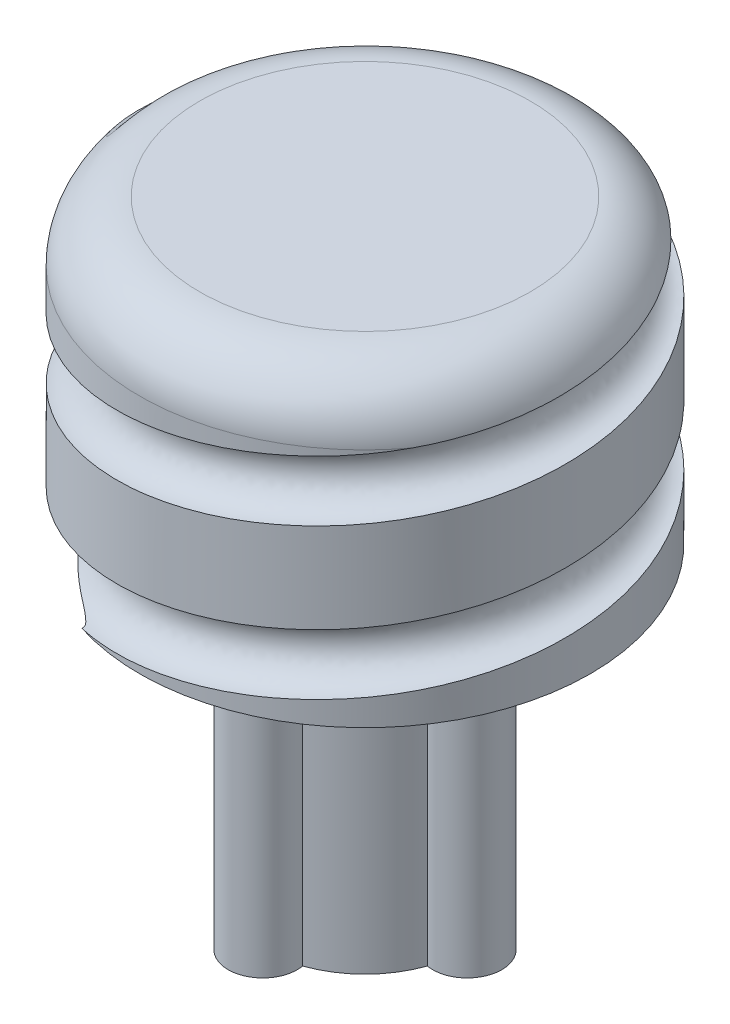
from build123d import *

# Parameters (mm, degrees)
SKETCH1_R           = 4.318
SKETCH1_R_2         = 1.4605
BOSS_EXTRUDE1_DEPTH = 12.7
SKETCH2_R           = 9.525
BOSS_EXTRUDE2_DEPTH = 12.7
FILLET1_R           = 2.54
CUT_SWEEP1_PITCH    = 6.35


with BuildPart() as part:
    # Sketch1 → Boss-Extrude1 (new body)
    with BuildSketch(Plane(origin=(0, 0, 0), x_dir=(1, 0, 0), z_dir=(0, 1, 0))):
        Circle(SKETCH1_R)
        with Locations((0, 4.318)):
            Circle(SKETCH1_R_2)
        Circle(SKETCH1_R)
        with Locations((0, 4.318)):
            Circle(SKETCH1_R_2)
        with Locations((-4.318, 0)):
            Circle(SKETCH1_R_2)
        Circle(SKETCH1_R)
        with Locations((0, -4.318)):
            Circle(SKETCH1_R_2)
        with Locations((4.318, 0)):
            Circle(SKETCH1_R_2)
        with Locations((0, 4.318)):
            Circle(SKETCH1_R_2)
        Circle(SKETCH1_R)
        with Locations((-4.318, 0)):
            Circle(SKETCH1_R_2)
        Circle(SKETCH1_R)
        with Locations((0, -4.318)):
            Circle(SKETCH1_R_2)
        Circle(SKETCH1_R)
        with Locations((-4.318, 0)):
            Circle(SKETCH1_R_2)
        Circle(SKETCH1_R)
        with Locations((4.318, 0)):
            Circle(SKETCH1_R_2)
        Circle(SKETCH1_R)
        with Locations((4.318, 0)):
            Circle(SKETCH1_R_2)
        Circle(SKETCH1_R)
        with Locations((0, -4.318)):
            Circle(SKETCH1_R_2)
    extrude(amount=BOSS_EXTRUDE1_DEPTH)

    # Sketch2 → Boss-Extrude2 (add)
    with BuildSketch(Plane(origin=(0, 12.7, 0), x_dir=(1, 0, 0), z_dir=(0, 1, 0))):
        with Locations(Location((0, 0, 0), (0, 0, 270))):
            Circle(SKETCH2_R)
    extrude(amount=BOSS_EXTRUDE2_DEPTH)

    # Fillet1
    # the kernel refuses this fillet: 2.54 mm, written as the material it adds along each edge
    with BuildSketch(Plane(origin=(0, 12.7, 0), x_dir=(0.9047999014546126, 0, 0.42583698562680433), z_dir=(0.42583698562680433, 0, -0.9047999014546126))) as fillet1_piece_1:
        with BuildLine():
            CenterArc((4.318 + FILLET1_R, FILLET1_R), FILLET1_R, 180, 90)
            Line((4.318, FILLET1_R), (4.318, 0))
            Line((4.318, 0), (4.318 + FILLET1_R, 0))
        make_face()
    revolve(axis=Axis((0, 12.7, 0), (0, -1, 0)), revolution_arc=219.592693243)
    with BuildSketch(Plane(origin=(0, 12.7, 0), x_dir=(-0.9047999014546126, 0, -0.4258369856268043), z_dir=(-0.4258369856268043, 0, 0.9047999014546126))) as fillet1_piece_2:
        with BuildLine():
            CenterArc((4.318 + FILLET1_R, FILLET1_R), FILLET1_R, 180, 90)
            Line((4.318, FILLET1_R), (4.318, 0))
            Line((4.318, 0), (4.318 + FILLET1_R, 0))
        make_face()
    revolve(axis=Axis((0, 12.7, 0), (0, -1, 0)), revolution_arc=219.592693243)

    # Cut-Sweep1: arcs per turn and ends read off the stored shape
    # Cut-Sweep1: the profile of Cut-Sweep1 profile screwed along a right-hand helix through 3.571428 turns, 14 arcs to a turn; built about Z, then put on its axis
    cut_sweep1_z = Axis((0, 0, 0), (0, 0, 1))
    cut_sweep1_corners = [(9.525, -0.133999022, -5.087088973), (10.795, 0, -6.35), (9.525, 0.133999022, -7.612911027), (8.255, 0, -6.35)]
    with BuildLine(mode=Mode.PRIVATE) as cut_sweep1_profile:
        ThreePointArc((9.525, -0.133999022, -5.087088973), (10.423025612, -0.094751617, -5.456987049), (10.795, 0, -6.35))
        ThreePointArc((10.795, 0, -6.35), (10.423025612, 0.094751617, -7.243012951), (9.525, 0.133999022, -7.612911027))
        ThreePointArc((9.525, 0.133999022, -7.612911027), (8.626974388, 0.094751617, -7.243012951), (8.255, 0, -6.35))
        ThreePointArc((8.255, 0, -6.35), (8.626974388, -0.094751617, -5.456987049), (9.525, -0.133999022, -5.087088973))
    cut_sweep1_cap = Face(cut_sweep1_profile.wire())
    cut_sweep1_arcs = [((9.525, -0.133999022, -5.087088973), (10.795, -0.133999022, -5.087088973), (10.795, 0, -6.35), (1, 0.7071067811865476, 1)), ((10.795, 0, -6.35), (10.795, 0.133999022, -7.612911027), (9.525, 0.133999022, -7.612911027), (1, 0.7071067811865476, 1)), ((9.525, 0.133999022, -7.612911027), (8.255, 0.133999022, -7.612911027), (8.255, 0, -6.35), (1, 0.7071067811865476, 1)), ((8.255, 0, -6.35), (8.255, -0.133999022, -5.087088973), (9.525, -0.133999022, -5.087088973), (1, 0.7071067811865476, 1))]  # start, shoulder, end, weights
    cut_sweep1_turn_angles = [0, 12.857142857, 25.714285714, 38.571428571, 51.428571429, 64.285714286, 77.142857143, 90, 102.857142857, 115.714285714, 128.571428571, 141.428571429, 154.285714286, 167.142857143, 180, 192.857142857, 205.714285714, 218.571428571, 231.428571429, 244.285714286, 257.142857143, 270, 282.857142857, 295.714285714, 308.571428571, 321.428571429, 334.285714286, 347.142857143, 360]
    cut_sweep1_turn_weights = [1, 0.9749279121818236, 1, 0.9749279121818236, 1, 0.9749279121818236, 1, 0.9749279121818236, 1, 0.9749279121818236, 1, 0.9749279121818236, 1, 0.9749279121818236, 1, 0.9749279121818236, 1, 0.9749279121818236, 1, 0.9749279121818236, 1, 0.9749279121818236, 1, 0.9749279121818237, 1, 0.9749279121818236, 1, 0.9749279121818236, 1]
    cut_sweep1_turn_sides = [Face.make_bezier_surface([[Vector(p[j][0], p[j][1], 0).rotate(cut_sweep1_z, cut_sweep1_turn_angles[2 * i + k]) / cut_sweep1_turn_weights[2 * i + k] + Vector(0, 0, p[j][2] + CUT_SWEEP1_PITCH * cut_sweep1_turn_angles[2 * i + k] / 360) for k in range(3)] for j in range(3)], [[p[3][j] * cut_sweep1_turn_weights[2 * i + k] for k in range(3)] for j in range(3)]) for p in cut_sweep1_arcs for i in range(14)]
    cut_sweep1_last_angles = [1080, 1092.857142857, 1105.714285714, 1118.571428571, 1131.428571429, 1144.285714286, 1157.142857143, 1170, 1182.857142857, 1195.714285714, 1208.571428571, 1221.428571429, 1234.285714286, 1247.142857143, 1260, 1272.857, 1285.714]
    cut_sweep1_last_weights = [1, 0.9749279121818235, 1, 0.974927912181824, 1, 0.9749279121818235, 1, 0.9749279121818235, 1, 0.9749279121818235, 1, 0.974927912181824, 1, 0.9749279121818235, 1, 0.9749284669963579, 1]
    cut_sweep1_last_sides = [Face.make_bezier_surface([[Vector(p[j][0], p[j][1], 0).rotate(cut_sweep1_z, cut_sweep1_last_angles[2 * i + k]) / cut_sweep1_last_weights[2 * i + k] + Vector(0, 0, p[j][2] + CUT_SWEEP1_PITCH * cut_sweep1_last_angles[2 * i + k] / 360) for k in range(3)] for j in range(3)], [[p[3][j] * cut_sweep1_last_weights[2 * i + k] for k in range(3)] for j in range(3)]) for p in cut_sweep1_arcs for i in range(8)]
    cut_sweep1 = Plane(origin=(0, 25.4, 0), x_dir=(-1, 0, 0), z_dir=(0, -1, 0)) * Solid(Shell([*[p.moved(Location((0, 0, CUT_SWEEP1_PITCH * i))) for i in range(3) for p in cut_sweep1_turn_sides], *cut_sweep1_last_sides, cut_sweep1_cap, cut_sweep1_cap.rotate(cut_sweep1_z, 1285.714).moved(Location((0, 0, CUT_SWEEP1_PITCH * 1285.714 / 360)))]))
    add(cut_sweep1, mode=Mode.SUBTRACT)

    # Fillet2: read off the stored shape, not the designer's step
    # Fillet2 outline → Fillet2 (revolve, cut)
    with BuildSketch(Plane.XY):
        with BuildLine():
            ThreePointArc((6.985, 25.4), (8.781051227, 24.656051221), (9.525, 22.859999991))
            Line((9.525, 22.859999991), (9.525, 25.4))
            Line((9.525, 25.4), (6.985, 25.4))
        make_face()
    revolve(axis=Axis((0, 0, 0), (0, 1, 0)), mode=Mode.SUBTRACT)


solid = part.part
